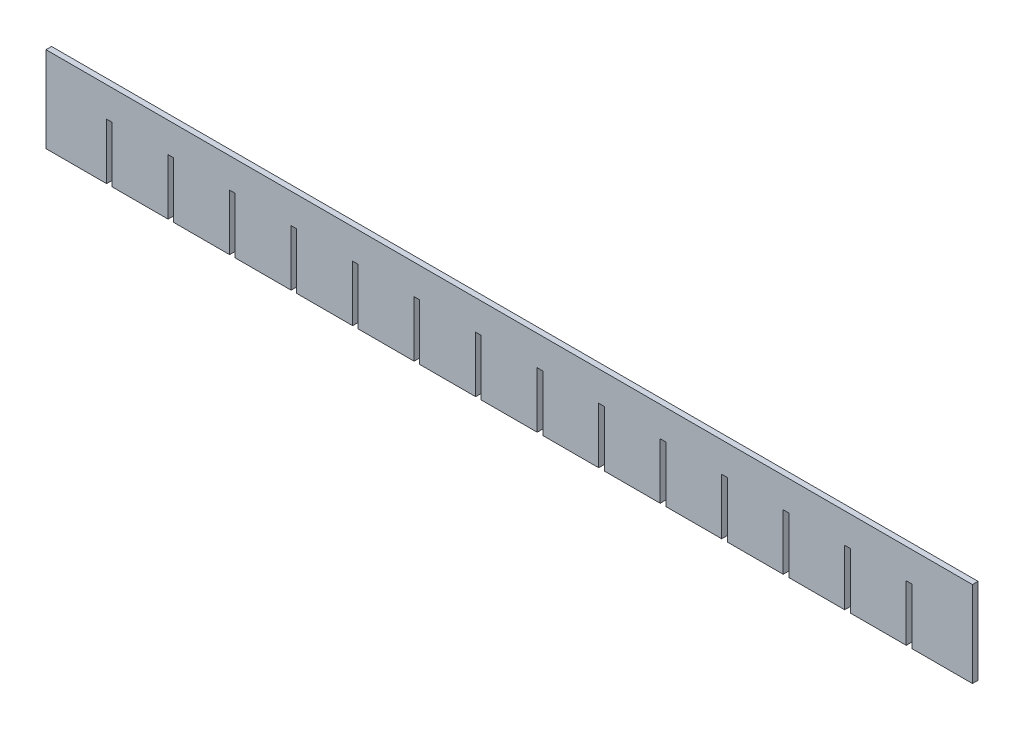
from build123d import *

# Parameters (mm, degrees)
SKETCH1_W           = 497
SKETCH1_H           = 46
BOSS_EXTRUDE1_DEPTH = 3
SKETCH2_W           = 3
SKETCH2_H           = 30
CUT_EXTRUDE1_DEPTH  = 250.580147448
LPATTERN1_COUNT     = 14
LPATTERN1_PITCH     = 33


with BuildPart() as part:
    # Sketch1 → Boss-Extrude1 (new body)
    with BuildSketch(Plane.XY):
        Rectangle(SKETCH1_W, SKETCH1_H)
    extrude(amount=BOSS_EXTRUDE1_DEPTH)

    # Sketch2 → Cut-Extrude1 (cut, through all)
    with BuildSketch(Plane.XY.offset(3)):
        with Locations((-214.5, -8)):
            Rectangle(SKETCH2_W, SKETCH2_H)
    cut_extrude1 = extrude(amount=-CUT_EXTRUDE1_DEPTH, mode=Mode.SUBTRACT)

    # LPattern1: Cut-Extrude1 ×14
    with Locations(*[(i * LPATTERN1_PITCH, 0, 0) for i in range(1, LPATTERN1_COUNT)]):
        add(cut_extrude1, mode=Mode.SUBTRACT)


solid = part.part
